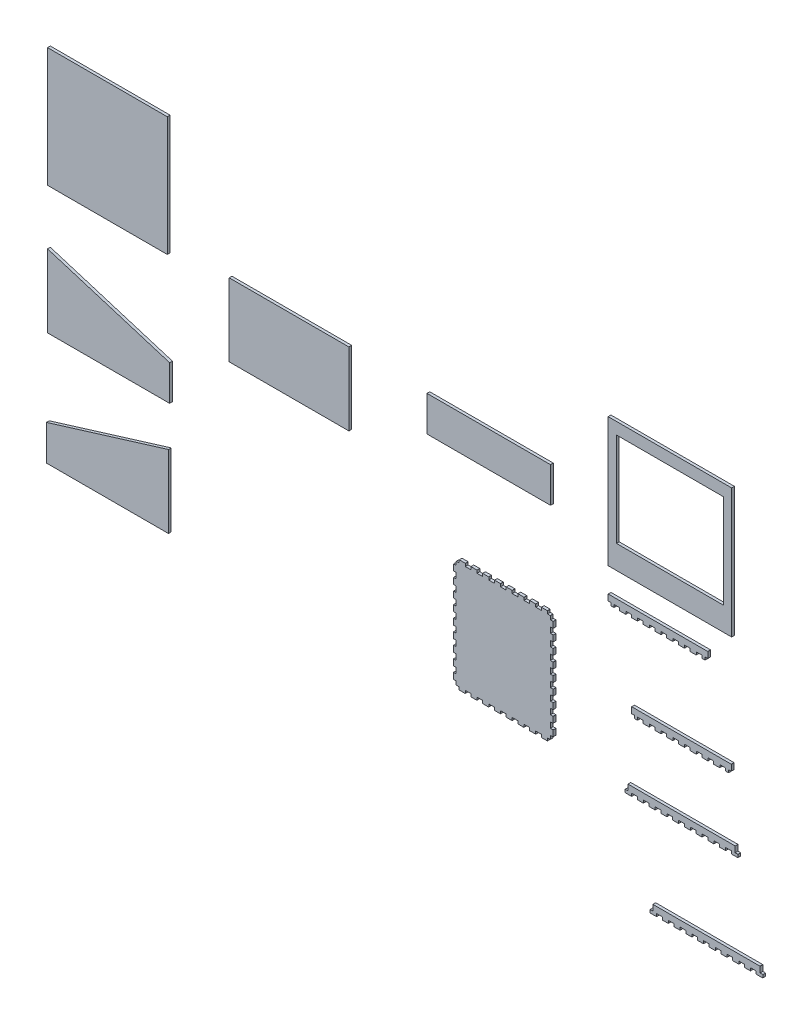
from build123d import *

# Parameters (mm, degrees)
BOSS_EXTRUDE1_DEPTH   = 3
LAYER_2_W             = 133.604
LAYER_2_H             = 139.7
LAYER_2_W_2           = 115.824
LAYER_2_H_2           = 101.6
BOSS_EXTRUDE2_DEPTH   = 3
BOSS_EXTRUDE3_DEPTH   = 3
LAYER_5_W             = 129.54
LAYER_5_H             = 78.74
BOSS_EXTRUDE4_DEPTH   = 3
BOSS_EXTRUDE5_DEPTH   = 3
LAYER_7_W             = 133.604
LAYER_7_H             = 38.1
BOSS_EXTRUDE6_DEPTH   = 3
LAYER_8_W             = 129.54
LAYER_8_H             = 129.032
BOSS_EXTRUDE7_DEPTH   = 3
BOSS_EXTRUDE8_DEPTH   = 3
BOSS_EXTRUDE8_2_DEPTH = 3
BOSS_EXTRUDE8_3_DEPTH = 3
BOSS_EXTRUDE8_4_DEPTH = 3


with BuildPart() as part:
    # Layer 3 → Boss-Extrude1 (new body)
    with BuildSketch(Plane.XY):
        Polygon((176.445680517, 644.154472161), (176.445680517, 682.254472161), (308.525680517, 722.894472161), (308.525680517, 644.154472161), align=None)
    extrude(amount=BOSS_EXTRUDE1_DEPTH)


with BuildPart() as body_2:
    # Layer 2 → Boss-Extrude2 (new body)
    with BuildSketch(Plane.XY):
        with Locations((851.016713692, 921.678278213)):
            Rectangle(LAYER_2_W, LAYER_2_H)
        with Locations((851.016713692, 928.028278213)):
            Rectangle(LAYER_2_W_2, LAYER_2_H_2, mode=Mode.SUBTRACT)
    extrude(amount=BOSS_EXTRUDE2_DEPTH)


with BuildPart() as body_3:
    # Layer 4 → Boss-Extrude3 (new body)
    with BuildSketch(Plane.XY):
        Polygon((177.715680517, 766.738278213), (177.715680517, 845.478278213), (309.795680517, 804.838278213), (309.795680517, 766.738278213), align=None)
    extrude(amount=BOSS_EXTRUDE3_DEPTH)


with BuildPart() as body_4:
    # Layer 5 → Boss-Extrude4 (new body)
    with BuildSketch(Plane.XY):
        with Locations((438.988588467, 877.228278213)):
            Rectangle(LAYER_5_W, LAYER_5_H)
    extrude(amount=BOSS_EXTRUDE4_DEPTH)


with BuildPart() as body_5:
    # Layer 6 → Boss-Extrude5 (new body)
    with BuildSketch(Plane.XY):
        Polygon((629.555478568, 654.788539442), (629.580878568, 654.813939442), (629.606278568, 654.839339442), (629.631678568, 654.864739442), (629.631678568, 657.760339442), (635.727678568, 657.760339442), (635.727678568, 654.864739442), (635.753078568, 654.839339442), (635.753078568, 654.813939442), (635.778478568, 654.788539442), (635.829278568, 654.763139442), (642.204678568, 654.763139442), (642.255478568, 654.788539442), (642.280878568, 654.813939442), (642.306278568, 654.839339442), (642.331678568, 654.864739442), (642.331678568, 657.760339442), (648.427678568, 657.760339442), (648.427678568, 654.864739442), (648.453078568, 654.839339442), (648.453078568, 654.813939442), (648.478478568, 654.788539442), (648.529278568, 654.763139442), (654.904678568, 654.763139442), (654.955478568, 654.788539442), (654.980878568, 654.813939442), (655.006278568, 654.839339442), (655.031678568, 654.864739442), (655.031678568, 657.760339442), (661.102278568, 657.760339442), (661.102278568, 654.864739442), (661.127678568, 654.839339442), (661.153078568, 654.813939442), (661.178478568, 654.788539442), (661.229278568, 654.763139442), (667.630078568, 654.763139442), (667.655478568, 654.788539442), (667.680878568, 654.788539442), (667.680878568, 654.813939442), (667.706278568, 654.813939442), (667.706278568, 654.839339442), (667.731678568, 654.864739442), (667.731678568, 657.760339442), (673.802278568, 657.760339442), (673.802278568, 654.864739442), (673.827678568, 654.839339442), (673.853078568, 654.813939442), (673.878478568, 654.788539442), (673.929278568, 654.763139442), (680.330078568, 654.763139442), (680.355478568, 654.788539442), (680.380878568, 654.788539442), (680.380878568, 654.813939442), (680.406278568, 654.813939442), (680.406278568, 654.839339442), (680.431678568, 654.864739442), (680.431678568, 657.760339442), (686.527678568, 657.760339442), (686.527678568, 654.864739442), (686.553078568, 654.839339442), (686.553078568, 654.813939442), (686.578478568, 654.788539442), (686.629278568, 654.763139442), (693.004678568, 654.763139442), (693.055478568, 654.788539442), (693.080878568, 654.813939442), (693.106278568, 654.839339442), (693.131678568, 654.864739442), (693.131678568, 657.760339442), (699.227678568, 657.760339442), (699.227678568, 654.864739442), (699.253078568, 654.839339442), (699.253078568, 654.813939442), (699.278478568, 654.788539442), (699.329278568, 654.763139442), (705.704678568, 654.763139442), (705.755478568, 654.788539442), (705.780878568, 654.813939442), (705.806278568, 654.839339442), (705.831678568, 654.864739442), (705.831678568, 657.760339442), (711.927678568, 657.760339442), (711.927678568, 654.864739442), (711.953078568, 654.839339442), (711.953078568, 654.813939442), (711.978478568, 654.788539442), (712.029278568, 654.763139442), (718.430078568, 654.763139442), (718.455478568, 654.788539442), (718.480878568, 654.788539442), (718.480878568, 654.813939442), (718.506278568, 654.813939442), (718.506278568, 654.839339442), (718.531678568, 654.864739442), (718.531678568, 657.760339442), (721.579678568, 657.760339442), (721.630478568, 657.785739442), (721.655878568, 657.811139442), (721.681278568, 657.811139442), (721.681278568, 657.836539442), (721.706678568, 657.861939442), (721.706678568, 661.697339442), (724.602278568, 661.697339442), (724.627678568, 661.722739442), (724.653078568, 661.722739442), (724.653078568, 661.748139442), (724.678478568, 661.773539442), (724.703878568, 661.824339442), (724.703878568, 668.199739442), (724.678478568, 668.225139442), (724.678478568, 668.250539442), (724.653078568, 668.250539442), (724.653078568, 668.275939442), (724.627678568, 668.275939442), (724.602278568, 668.301339442), (721.706678568, 668.301339442), (721.706678568, 674.397339442), (724.602278568, 674.397339442), (724.627678568, 674.422739442), (724.653078568, 674.422739442), (724.678478568, 674.448139442), (724.678478568, 674.473539442), (724.703878568, 674.498939442), (724.703878568, 680.899739442), (724.678478568, 680.950539442), (724.653078568, 680.975939442), (724.627678568, 681.001339442), (724.602278568, 681.001339442), (721.706678568, 681.001339442), (721.706678568, 687.097339442), (724.602278568, 687.097339442), (724.627678568, 687.122739442), (724.653078568, 687.122739442), (724.678478568, 687.148139442), (724.678478568, 687.173539442), (724.703878568, 687.198939442), (724.703878568, 693.599739442), (724.678478568, 693.650539442), (724.653078568, 693.675939442), (724.627678568, 693.701339442), (724.602278568, 693.701339442), (721.706678568, 693.701339442), (721.706678568, 699.797339442), (724.602278568, 699.797339442), (724.627678568, 699.822739442), (724.653078568, 699.822739442), (724.678478568, 699.848139442), (724.678478568, 699.873539442), (724.703878568, 699.898939442), (724.703878568, 706.299739442), (724.678478568, 706.325139442), (724.678478568, 706.350539442), (724.653078568, 706.350539442), (724.653078568, 706.375939442), (724.627678568, 706.375939442), (724.602278568, 706.401339442), (721.706678568, 706.401339442), (721.706678568, 712.497339442), (724.602278568, 712.497339442), (724.627678568, 712.522739442), (724.653078568, 712.522739442), (724.653078568, 712.548139442), (724.678478568, 712.573539442), (724.703878568, 712.624339442), (724.703878568, 718.999739442), (724.678478568, 719.025139442), (724.678478568, 719.050539442), (724.653078568, 719.050539442), (724.653078568, 719.075939442), (724.627678568, 719.075939442), (724.602278568, 719.101339442), (721.706678568, 719.101339442), (721.706678568, 725.197339442), (724.602278568, 725.197339442), (724.627678568, 725.222739442), (724.653078568, 725.222739442), (724.653078568, 725.248139442), (724.678478568, 725.273539442), (724.703878568, 725.324339442), (724.703878568, 731.699739442), (724.678478568, 731.750539442), (724.653078568, 731.775939442), (724.627678568, 731.801339442), (724.602278568, 731.801339442), (721.706678568, 731.801339442), (721.706678568, 737.897339442), (724.602278568, 737.897339442), (724.627678568, 737.922739442), (724.653078568, 737.922739442), (724.678478568, 737.948139442), (724.678478568, 737.973539442), (724.703878568, 737.998939442), (724.703878568, 744.399739442), (724.678478568, 744.450539442), (724.653078568, 744.475939442), (724.627678568, 744.501339442), (724.602278568, 744.501339442), (721.706678568, 744.501339442), (721.706678568, 750.597339442), (724.602278568, 750.597339442), (724.627678568, 750.622739442), (724.653078568, 750.622739442), (724.678478568, 750.648139442), (724.678478568, 750.673539442), (724.703878568, 750.698939442), (724.703878568, 757.099739442), (724.678478568, 757.150539442), (724.653078568, 757.175939442), (724.627678568, 757.201339442), (724.602278568, 757.201339442), (721.706678568, 757.201339442), (721.706678568, 763.297339442), (724.602278568, 763.297339442), (724.627678568, 763.322739442), (724.653078568, 763.322739442), (724.653078568, 763.348139442), (724.678478568, 763.373539442), (724.703878568, 763.424339442), (724.703878568, 769.799739442), (724.678478568, 769.825139442), (724.678478568, 769.850539442), (724.653078568, 769.850539442), (724.653078568, 769.875939442), (724.627678568, 769.875939442), (724.602278568, 769.901339442), (721.706678568, 769.901339442), (721.706678568, 773.736739442), (721.681278568, 773.762139442), (721.681278568, 773.787539442), (721.655878568, 773.812939442), (721.630478568, 773.812939442), (721.579678568, 773.838339442), (718.531678568, 773.838339442), (718.531678568, 776.733939442), (718.506278568, 776.784739442), (718.480878568, 776.810139442), (718.455478568, 776.835539442), (718.430078568, 776.835539442), (712.029278568, 776.835539442), (711.978478568, 776.835539442), (711.978478568, 776.810139442), (711.953078568, 776.810139442), (711.953078568, 776.784739442), (711.927678568, 776.733939442), (711.927678568, 773.838339442), (705.831678568, 773.838339442), (705.831678568, 776.733939442), (705.806278568, 776.784739442), (705.780878568, 776.784739442), (705.780878568, 776.810139442), (705.755478568, 776.810139442), (705.755478568, 776.835539442), (705.704678568, 776.835539442), (699.329278568, 776.835539442), (699.278478568, 776.835539442), (699.278478568, 776.810139442), (699.253078568, 776.810139442), (699.253078568, 776.784739442), (699.227678568, 776.733939442), (699.227678568, 773.838339442), (693.131678568, 773.838339442), (693.131678568, 776.733939442), (693.106278568, 776.784739442), (693.080878568, 776.784739442), (693.080878568, 776.810139442), (693.055478568, 776.810139442), (693.055478568, 776.835539442), (693.004678568, 776.835539442), (686.629278568, 776.835539442), (686.578478568, 776.835539442), (686.578478568, 776.810139442), (686.553078568, 776.810139442), (686.553078568, 776.784739442), (686.527678568, 776.733939442), (686.527678568, 773.838339442), (680.431678568, 773.838339442), (680.431678568, 776.733939442), (680.406278568, 776.784739442), (680.380878568, 776.810139442), (680.355478568, 776.835539442), (680.330078568, 776.835539442), (673.929278568, 776.835539442), (673.878478568, 776.835539442), (673.878478568, 776.810139442), (673.853078568, 776.810139442), (673.853078568, 776.784739442), (673.827678568, 776.784739442), (673.802278568, 776.733939442), (673.802278568, 773.838339442), (667.731678568, 773.838339442), (667.731678568, 776.733939442), (667.706278568, 776.784739442), (667.680878568, 776.810139442), (667.655478568, 776.835539442), (667.630078568, 776.835539442), (661.229278568, 776.835539442), (661.178478568, 776.835539442), (661.178478568, 776.810139442), (661.153078568, 776.810139442), (661.153078568, 776.784739442), (661.127678568, 776.784739442), (661.102278568, 776.733939442), (661.102278568, 773.838339442), (655.031678568, 773.838339442), (655.031678568, 776.733939442), (655.006278568, 776.784739442), (654.980878568, 776.784739442), (654.980878568, 776.810139442), (654.955478568, 776.810139442), (654.955478568, 776.835539442), (654.904678568, 776.835539442), (648.529278568, 776.835539442), (648.478478568, 776.835539442), (648.478478568, 776.810139442), (648.453078568, 776.810139442), (648.453078568, 776.784739442), (648.427678568, 776.733939442), (648.427678568, 773.838339442), (642.331678568, 773.838339442), (642.331678568, 776.733939442), (642.306278568, 776.784739442), (642.280878568, 776.784739442), (642.280878568, 776.810139442), (642.255478568, 776.810139442), (642.255478568, 776.835539442), (642.204678568, 776.835539442), (635.829278568, 776.835539442), (635.778478568, 776.835539442), (635.778478568, 776.810139442), (635.753078568, 776.810139442), (635.753078568, 776.784739442), (635.727678568, 776.733939442), (635.727678568, 773.838339442), (629.631678568, 773.838339442), (629.631678568, 776.733939442), (629.606278568, 776.784739442), (629.580878568, 776.784739442), (629.580878568, 776.810139442), (629.555478568, 776.810139442), (629.555478568, 776.835539442), (629.504678568, 776.835539442), (623.129278568, 776.835539442), (623.078478568, 776.835539442), (623.078478568, 776.810139442), (623.053078568, 776.810139442), (623.053078568, 776.784739442), (623.027678568, 776.784739442), (623.002278568, 776.733939442), (623.002278568, 773.838339442), (619.954278568, 773.838339442), (619.903478568, 773.812939442), (619.878078568, 773.812939442), (619.878078568, 773.787539442), (619.852678568, 773.762139442), (619.852678568, 773.736739442), (619.852678568, 769.901339442), (616.957078568, 769.901339442), (616.906278568, 769.875939442), (616.880878568, 769.850539442), (616.855478568, 769.825139442), (616.830078568, 769.799739442), (616.830078568, 763.424339442), (616.855478568, 763.373539442), (616.880878568, 763.373539442), (616.880878568, 763.348139442), (616.906278568, 763.322739442), (616.957078568, 763.297339442), (619.852678568, 763.297339442), (619.852678568, 757.201339442), (616.957078568, 757.201339442), (616.906278568, 757.201339442), (616.906278568, 757.175939442), (616.880878568, 757.175939442), (616.880878568, 757.150539442), (616.855478568, 757.150539442), (616.830078568, 757.099739442), (616.830078568, 750.698939442), (616.855478568, 750.673539442), (616.880878568, 750.648139442), (616.880878568, 750.622739442), (616.906278568, 750.622739442), (616.957078568, 750.597339442), (619.852678568, 750.597339442), (619.852678568, 744.501339442), (616.957078568, 744.501339442), (616.906278568, 744.501339442), (616.906278568, 744.475939442), (616.880878568, 744.475939442), (616.880878568, 744.450539442), (616.855478568, 744.450539442), (616.830078568, 744.399739442), (616.830078568, 737.998939442), (616.855478568, 737.973539442), (616.880878568, 737.948139442), (616.880878568, 737.922739442), (616.906278568, 737.922739442), (616.957078568, 737.897339442), (619.852678568, 737.897339442), (619.852678568, 731.801339442), (616.957078568, 731.801339442), (616.906278568, 731.801339442), (616.906278568, 731.775939442), (616.880878568, 731.775939442), (616.880878568, 731.750539442), (616.855478568, 731.750539442), (616.830078568, 731.699739442), (616.830078568, 725.324339442), (616.855478568, 725.273539442), (616.880878568, 725.273539442), (616.880878568, 725.248139442), (616.906278568, 725.222739442), (616.957078568, 725.197339442), (619.852678568, 725.197339442), (619.852678568, 719.101339442), (616.957078568, 719.101339442), (616.906278568, 719.075939442), (616.880878568, 719.050539442), (616.855478568, 719.025139442), (616.830078568, 718.999739442), (616.830078568, 712.624339442), (616.855478568, 712.573539442), (616.880878568, 712.573539442), (616.880878568, 712.548139442), (616.906278568, 712.522739442), (616.957078568, 712.497339442), (619.852678568, 712.497339442), (619.852678568, 706.401339442), (616.957078568, 706.401339442), (616.906278568, 706.375939442), (616.880878568, 706.350539442), (616.855478568, 706.325139442), (616.830078568, 706.299739442), (616.830078568, 699.898939442), (616.855478568, 699.873539442), (616.880878568, 699.848139442), (616.880878568, 699.822739442), (616.906278568, 699.822739442), (616.957078568, 699.797339442), (619.852678568, 699.797339442), (619.852678568, 693.701339442), (616.957078568, 693.701339442), (616.906278568, 693.701339442), (616.906278568, 693.675939442), (616.880878568, 693.675939442), (616.880878568, 693.650539442), (616.855478568, 693.650539442), (616.830078568, 693.599739442), (616.830078568, 687.198939442), (616.855478568, 687.173539442), (616.880878568, 687.148139442), (616.880878568, 687.122739442), (616.906278568, 687.122739442), (616.957078568, 687.097339442), (619.852678568, 687.097339442), (619.852678568, 681.001339442), (616.957078568, 681.001339442), (616.906278568, 681.001339442), (616.906278568, 680.975939442), (616.880878568, 680.975939442), (616.880878568, 680.950539442), (616.855478568, 680.950539442), (616.830078568, 680.899739442), (616.830078568, 674.498939442), (616.855478568, 674.473539442), (616.880878568, 674.448139442), (616.880878568, 674.422739442), (616.906278568, 674.422739442), (616.957078568, 674.397339442), (619.852678568, 674.397339442), (619.852678568, 668.301339442), (616.957078568, 668.301339442), (616.906278568, 668.275939442), (616.880878568, 668.250539442), (616.855478568, 668.225139442), (616.830078568, 668.199739442), (616.830078568, 661.824339442), (616.855478568, 661.773539442), (616.880878568, 661.773539442), (616.880878568, 661.748139442), (616.906278568, 661.722739442), (616.957078568, 661.697339442), (619.852678568, 661.697339442), (619.852678568, 657.861939442), (619.852678568, 657.836539442), (619.878078568, 657.811139442), (619.903478568, 657.785739442), (619.954278568, 657.760339442), (623.002278568, 657.760339442), (623.002278568, 654.864739442), (623.027678568, 654.839339442), (623.053078568, 654.813939442), (623.078478568, 654.788539442), (623.129278568, 654.763139442), (629.504678568, 654.763139442), align=None)
    extrude(amount=BOSS_EXTRUDE5_DEPTH)


with BuildPart() as body_6:
    # Layer 7 → Boss-Extrude6 (new body)
    with BuildSketch(Plane.XY):
        with Locations((655.031678568, 896.278278213)):
            Rectangle(LAYER_7_W, LAYER_7_H)
    extrude(amount=BOSS_EXTRUDE6_DEPTH)


with BuildPart() as body_7:
    # Layer 8 → Boss-Extrude7 (new body)
    with BuildSketch(Plane.XY):
        with Locations((242.485680517, 969.506478213)):
            Rectangle(LAYER_8_W, LAYER_8_H)
    extrude(amount=BOSS_EXTRUDE7_DEPTH)


with BuildPart() as body_8:
    # Layer 9 → Boss-Extrude8 (new body)
    with BuildSketch(Plane.XY):
        Polygon((815.964713692, 722.919872161), (815.990113692, 722.919872161), (816.015513692, 722.945272161), (816.015513692, 722.970672161), (816.040913692, 722.996072161), (816.040913692, 725.891672161), (822.136913692, 725.891672161), (822.136913692, 722.996072161), (822.162313692, 722.970672161), (822.162313692, 722.945272161), (822.187713692, 722.919872161), (822.213113692, 722.919872161), (822.238513692, 722.894472161), (828.639313692, 722.894472161), (828.690113692, 722.919872161), (828.715513692, 722.945272161), (828.740913692, 722.970672161), (828.766313692, 722.996072161), (828.766313692, 725.891672161), (834.836913692, 725.891672161), (834.836913692, 722.996072161), (834.862313692, 722.970672161), (834.862313692, 722.945272161), (834.887713692, 722.919872161), (834.913113692, 722.919872161), (834.938513692, 722.894472161), (841.339313692, 722.894472161), (841.390113692, 722.919872161), (841.415513692, 722.945272161), (841.440913692, 722.970672161), (841.466313692, 722.996072161), (841.466313692, 725.891672161), (847.536913692, 725.891672161), (847.536913692, 722.996072161), (847.562313692, 722.970672161), (847.562313692, 722.945272161), (847.587713692, 722.919872161), (847.613113692, 722.919872161), (847.638513692, 722.894472161), (854.039313692, 722.894472161), (854.064713692, 722.919872161), (854.090113692, 722.919872161), (854.115513692, 722.945272161), (854.115513692, 722.970672161), (854.140913692, 722.996072161), (854.140913692, 725.891672161), (860.236913692, 725.891672161), (860.236913692, 722.996072161), (860.262313692, 722.970672161), (860.262313692, 722.945272161), (860.287713692, 722.945272161), (860.313113692, 722.919872161), (860.363913692, 722.894472161), (866.739313692, 722.894472161), (866.764713692, 722.919872161), (866.790113692, 722.919872161), (866.815513692, 722.945272161), (866.815513692, 722.970672161), (866.840913692, 722.996072161), (866.840913692, 725.891672161), (872.936913692, 725.891672161), (872.936913692, 722.996072161), (872.962313692, 722.970672161), (872.962313692, 722.945272161), (872.987713692, 722.945272161), (873.013113692, 722.919872161), (873.063913692, 722.894472161), (879.439313692, 722.894472161), (879.490113692, 722.919872161), (879.515513692, 722.945272161), (879.540913692, 722.970672161), (879.566313692, 722.996072161), (879.566313692, 725.891672161), (885.636913692, 725.891672161), (885.636913692, 722.996072161), (885.662313692, 722.970672161), (885.662313692, 722.945272161), (885.687713692, 722.919872161), (885.713113692, 722.919872161), (885.738513692, 722.894472161), (892.139313692, 722.894472161), (892.190113692, 722.919872161), (892.215513692, 722.945272161), (892.240913692, 722.970672161), (892.266313692, 722.996072161), (892.266313692, 725.891672161), (898.336913692, 725.891672161), (898.336913692, 722.996072161), (898.362313692, 722.970672161), (898.362313692, 722.945272161), (898.387713692, 722.919872161), (898.413113692, 722.919872161), (898.438513692, 722.894472161), (904.839313692, 722.894472161), (904.890113692, 722.919872161), (904.915513692, 722.945272161), (904.940913692, 722.970672161), (904.966313692, 722.996072161), (904.966313692, 725.891672161), (911.036913692, 725.891672161), (911.036913692, 722.996072161), (911.062313692, 722.970672161), (911.062313692, 722.945272161), (911.087713692, 722.945272161), (911.113113692, 722.919872161), (911.163913692, 722.894472161), (914.364313692, 722.894472161), (914.415113692, 722.919872161), (914.440513692, 722.945272161), (914.465913692, 722.970672161), (914.465913692, 722.996072161), (914.465913692, 725.891672161), (917.361513692, 725.891672161), (917.412313692, 725.917072161), (917.437713692, 725.942472161), (917.437713692, 725.967872161), (917.463113692, 725.967872161), (917.463113692, 726.018672161), (917.463113692, 732.394072161), (917.463113692, 732.419472161), (917.437713692, 732.444872161), (917.437713692, 732.470272161), (917.412313692, 732.470272161), (917.361513692, 732.495672161), (809.716313692, 732.495672161), (809.690913692, 732.470272161), (809.665513692, 732.470272161), (809.640113692, 732.444872161), (809.640113692, 732.419472161), (809.614713692, 732.394072161), (809.614713692, 726.018672161), (809.640113692, 725.967872161), (809.665513692, 725.942472161), (809.665513692, 725.917072161), (809.690913692, 725.917072161), (809.716313692, 725.891672161), (812.611913692, 725.891672161), (812.611913692, 722.996072161), (812.637313692, 722.970672161), (812.637313692, 722.945272161), (812.662713692, 722.945272161), (812.662713692, 722.919872161), (812.688113692, 722.919872161), (812.713513692, 722.894472161), (815.939313692, 722.894472161), align=None)
    extrude(amount=BOSS_EXTRUDE8_DEPTH)


with BuildPart() as body_9:
    # Layer 9 → Boss-Extrude8 2 (new body)
    with BuildSketch(Plane.XY):
        Polygon((790.564713692, 815.811078213), (790.590113692, 815.811078213), (790.615513692, 815.836478213), (790.615513692, 815.861878213), (790.640913692, 815.912678213), (790.640913692, 818.782878213), (796.736913692, 818.782878213), (796.736913692, 815.912678213), (796.762313692, 815.861878213), (796.762313692, 815.836478213), (796.787713692, 815.811078213), (796.813113692, 815.811078213), (796.838513692, 815.785678213), (803.239313692, 815.785678213), (803.290113692, 815.811078213), (803.315513692, 815.836478213), (803.315513692, 815.861878213), (803.340913692, 815.861878213), (803.366313692, 815.912678213), (803.366313692, 818.782878213), (809.436913692, 818.782878213), (809.436913692, 815.912678213), (809.462313692, 815.861878213), (809.462313692, 815.836478213), (809.487713692, 815.811078213), (809.513113692, 815.811078213), (809.538513692, 815.785678213), (815.939313692, 815.785678213), (815.990113692, 815.811078213), (816.015513692, 815.836478213), (816.015513692, 815.861878213), (816.040913692, 815.861878213), (816.066313692, 815.912678213), (816.066313692, 818.782878213), (822.136913692, 818.782878213), (822.136913692, 815.912678213), (822.162313692, 815.861878213), (822.162313692, 815.836478213), (822.187713692, 815.811078213), (822.213113692, 815.811078213), (822.238513692, 815.785678213), (828.639313692, 815.785678213), (828.664713692, 815.811078213), (828.690113692, 815.811078213), (828.715513692, 815.836478213), (828.715513692, 815.861878213), (828.740913692, 815.912678213), (828.740913692, 818.782878213), (834.836913692, 818.782878213), (834.836913692, 815.912678213), (834.862313692, 815.861878213), (834.887713692, 815.836478213), (834.913113692, 815.811078213), (834.963913692, 815.785678213), (841.339313692, 815.785678213), (841.364713692, 815.811078213), (841.390113692, 815.811078213), (841.415513692, 815.836478213), (841.415513692, 815.861878213), (841.440913692, 815.912678213), (841.440913692, 818.782878213), (847.536913692, 818.782878213), (847.536913692, 815.912678213), (847.562313692, 815.861878213), (847.587713692, 815.836478213), (847.613113692, 815.811078213), (847.663913692, 815.785678213), (854.039313692, 815.785678213), (854.090113692, 815.811078213), (854.115513692, 815.836478213), (854.115513692, 815.861878213), (854.140913692, 815.861878213), (854.166313692, 815.912678213), (854.166313692, 818.782878213), (860.236913692, 818.782878213), (860.236913692, 815.912678213), (860.262313692, 815.861878213), (860.262313692, 815.836478213), (860.287713692, 815.811078213), (860.313113692, 815.811078213), (860.338513692, 815.785678213), (866.739313692, 815.785678213), (866.790113692, 815.811078213), (866.815513692, 815.836478213), (866.815513692, 815.861878213), (866.840913692, 815.861878213), (866.866313692, 815.912678213), (866.866313692, 818.782878213), (872.936913692, 818.782878213), (872.936913692, 815.912678213), (872.962313692, 815.861878213), (872.962313692, 815.836478213), (872.987713692, 815.811078213), (873.013113692, 815.811078213), (873.038513692, 815.785678213), (879.439313692, 815.785678213), (879.490113692, 815.811078213), (879.515513692, 815.836478213), (879.515513692, 815.861878213), (879.540913692, 815.861878213), (879.566313692, 815.912678213), (879.566313692, 818.782878213), (885.636913692, 818.782878213), (885.636913692, 815.912678213), (885.662313692, 815.861878213), (885.687713692, 815.836478213), (885.713113692, 815.811078213), (885.763913692, 815.785678213), (888.964313692, 815.785678213), (889.015113692, 815.811078213), (889.040513692, 815.836478213), (889.040513692, 815.861878213), (889.065913692, 815.861878213), (889.065913692, 815.912678213), (889.065913692, 818.782878213), (891.961513692, 818.782878213), (892.012313692, 818.808278213), (892.037713692, 818.833678213), (892.037713692, 818.859078213), (892.063113692, 818.859078213), (892.063113692, 818.909878213), (892.063113692, 825.285278213), (892.063113692, 825.310678213), (892.037713692, 825.336078213), (892.037713692, 825.361478213), (892.012313692, 825.361478213), (891.961513692, 825.386878213), (784.316313692, 825.386878213), (784.290913692, 825.361478213), (784.265513692, 825.361478213), (784.240113692, 825.336078213), (784.240113692, 825.310678213), (784.214713692, 825.285278213), (784.214713692, 818.909878213), (784.240113692, 818.859078213), (784.265513692, 818.833678213), (784.265513692, 818.808278213), (784.290913692, 818.808278213), (784.316313692, 818.782878213), (787.211913692, 818.782878213), (787.211913692, 815.912678213), (787.237313692, 815.861878213), (787.262713692, 815.836478213), (787.262713692, 815.811078213), (787.288113692, 815.811078213), (787.313513692, 815.785678213), (790.539313692, 815.785678213), align=None)
    extrude(amount=BOSS_EXTRUDE8_2_DEPTH)


with BuildPart() as body_10:
    # Layer 9 → Boss-Extrude8 3 (new body)
    with BuildSketch(Plane.XY):
        Polygon((836.614913692, 549.22072238), (836.640313692, 549.24612238), (836.665713692, 549.27152238), (836.665713692, 549.29692238), (836.665713692, 552.19252238), (842.761713692, 552.19252238), (842.761713692, 549.29692238), (842.787113692, 549.27152238), (842.787113692, 549.24612238), (842.812513692, 549.22072238), (842.837913692, 549.22072238), (842.863313692, 549.19532238), (849.264113692, 549.19532238), (849.289513692, 549.22072238), (849.314913692, 549.22072238), (849.314913692, 549.24612238), (849.340313692, 549.24612238), (849.340313692, 549.27152238), (849.365713692, 549.29692238), (849.365713692, 552.19252238), (855.461713692, 552.19252238), (855.461713692, 549.29692238), (855.487113692, 549.27152238), (855.487113692, 549.24612238), (855.512513692, 549.24612238), (855.537913692, 549.22072238), (855.588713692, 549.19532238), (861.964113692, 549.19532238), (861.989513692, 549.22072238), (862.014913692, 549.22072238), (862.014913692, 549.24612238), (862.040313692, 549.24612238), (862.040313692, 549.27152238), (862.065713692, 549.29692238), (862.065713692, 552.19252238), (868.161713692, 552.19252238), (868.161713692, 549.29692238), (868.187113692, 549.27152238), (868.187113692, 549.24612238), (868.212513692, 549.24612238), (868.237913692, 549.22072238), (868.288713692, 549.19532238), (874.664113692, 549.19532238), (874.689513692, 549.22072238), (874.714913692, 549.22072238), (874.714913692, 549.24612238), (874.740313692, 549.24612238), (874.740313692, 549.27152238), (874.765713692, 549.29692238), (874.765713692, 552.19252238), (880.861713692, 552.19252238), (880.861713692, 549.29692238), (880.887113692, 549.27152238), (880.887113692, 549.24612238), (880.912513692, 549.22072238), (880.937913692, 549.22072238), (880.963313692, 549.19532238), (887.364113692, 549.19532238), (887.414913692, 549.22072238), (887.440313692, 549.24612238), (887.465713692, 549.27152238), (887.465713692, 549.29692238), (887.465713692, 552.19252238), (893.561713692, 552.19252238), (893.561713692, 549.29692238), (893.587113692, 549.27152238), (893.587113692, 549.24612238), (893.612513692, 549.22072238), (893.637913692, 549.22072238), (893.663313692, 549.19532238), (900.064113692, 549.19532238), (900.114913692, 549.22072238), (900.140313692, 549.24612238), (900.165713692, 549.27152238), (900.165713692, 549.29692238), (900.165713692, 552.19252238), (906.261713692, 552.19252238), (906.261713692, 549.29692238), (906.287113692, 549.27152238), (906.287113692, 549.24612238), (906.312513692, 549.24612238), (906.337913692, 549.22072238), (906.388713692, 549.19532238), (912.764113692, 549.19532238), (912.789513692, 549.22072238), (912.814913692, 549.22072238), (912.814913692, 549.24612238), (912.840313692, 549.24612238), (912.840313692, 549.27152238), (912.865713692, 549.29692238), (912.865713692, 552.19252238), (918.961713692, 552.19252238), (918.961713692, 549.29692238), (918.987113692, 549.27152238), (918.987113692, 549.24612238), (919.012513692, 549.24612238), (919.037913692, 549.22072238), (919.088713692, 549.19532238), (925.464113692, 549.19532238), (925.489513692, 549.22072238), (925.514913692, 549.22072238), (925.514913692, 549.24612238), (925.540313692, 549.24612238), (925.540313692, 549.27152238), (925.565713692, 549.29692238), (925.565713692, 552.19252238), (931.661713692, 552.19252238), (931.661713692, 549.29692238), (931.687113692, 549.27152238), (931.687113692, 549.24612238), (931.712513692, 549.24612238), (931.737913692, 549.22072238), (931.788713692, 549.19532238), (938.164113692, 549.19532238), (938.214913692, 549.22072238), (938.240313692, 549.24612238), (938.265713692, 549.27152238), (938.265713692, 549.29692238), (938.265713692, 552.19252238), (944.361713692, 552.19252238), (944.361713692, 549.29692238), (944.387113692, 549.27152238), (944.387113692, 549.24612238), (944.412513692, 549.22072238), (944.437913692, 549.22072238), (944.463313692, 549.19532238), (951.448313692, 549.19532238), (951.499113692, 549.22072238), (951.524513692, 549.24612238), (951.549913692, 549.27152238), (951.549913692, 549.29692238), (951.549913692, 552.34492238), (951.549913692, 552.39572238), (951.524513692, 552.39572238), (951.524513692, 552.42112238), (951.499113692, 552.42112238), (951.499113692, 552.44652238), (951.448313692, 552.44652238), (948.552713692, 552.44652238), (948.552713692, 558.69492238), (948.527313692, 558.72032238), (948.527313692, 558.74572238), (948.501913692, 558.77112238), (948.476513692, 558.77112238), (948.451113692, 558.79652238), (832.576313692, 558.79652238), (832.550913692, 558.77112238), (832.525513692, 558.77112238), (832.525513692, 558.74572238), (832.500113692, 558.74572238), (832.500113692, 558.72032238), (832.474713692, 558.69492238), (832.474713692, 552.44652238), (829.579113692, 552.44652238), (829.553713692, 552.44652238), (829.528313692, 552.42112238), (829.502913692, 552.39572238), (829.477513692, 552.34492238), (829.477513692, 549.29692238), (829.502913692, 549.27152238), (829.502913692, 549.24612238), (829.528313692, 549.24612238), (829.528313692, 549.22072238), (829.553713692, 549.22072238), (829.579113692, 549.19532238), (836.564113692, 549.19532238), align=None)
    extrude(amount=BOSS_EXTRUDE8_3_DEPTH)


with BuildPart() as body_11:
    # Layer 9 → Boss-Extrude8 4 (new body)
    with BuildSketch(Plane.XY):
        Polygon((809.640113692, 648.413139442), (809.665513692, 648.438539442), (809.690913692, 648.463939442), (809.690913692, 648.489339442), (809.690913692, 651.384939442), (815.786913692, 651.384939442), (815.786913692, 648.489339442), (815.812313692, 648.463939442), (815.812313692, 648.438539442), (815.837713692, 648.413139442), (815.863113692, 648.413139442), (815.888513692, 648.387739442), (822.289313692, 648.387739442), (822.314713692, 648.413139442), (822.340113692, 648.413139442), (822.340113692, 648.438539442), (822.365513692, 648.438539442), (822.365513692, 648.463939442), (822.390913692, 648.489339442), (822.390913692, 651.384939442), (828.486913692, 651.384939442), (828.486913692, 648.489339442), (828.512313692, 648.463939442), (828.512313692, 648.438539442), (828.537713692, 648.438539442), (828.563113692, 648.413139442), (828.613913692, 648.387739442), (834.989313692, 648.387739442), (835.014713692, 648.413139442), (835.040113692, 648.413139442), (835.040113692, 648.438539442), (835.065513692, 648.438539442), (835.065513692, 648.463939442), (835.090913692, 648.489339442), (835.090913692, 651.384939442), (841.186913692, 651.384939442), (841.186913692, 648.489339442), (841.212313692, 648.463939442), (841.212313692, 648.438539442), (841.237713692, 648.438539442), (841.263113692, 648.413139442), (841.313913692, 648.387739442), (847.689313692, 648.387739442), (847.714713692, 648.413139442), (847.740113692, 648.413139442), (847.740113692, 648.438539442), (847.765513692, 648.438539442), (847.765513692, 648.463939442), (847.790913692, 648.489339442), (847.790913692, 651.384939442), (853.886913692, 651.384939442), (853.886913692, 648.489339442), (853.912313692, 648.463939442), (853.912313692, 648.438539442), (853.937713692, 648.413139442), (853.963113692, 648.413139442), (853.988513692, 648.387739442), (860.389313692, 648.387739442), (860.440113692, 648.413139442), (860.465513692, 648.438539442), (860.490913692, 648.463939442), (860.490913692, 648.489339442), (860.490913692, 651.384939442), (866.586913692, 651.384939442), (866.586913692, 648.489339442), (866.612313692, 648.463939442), (866.612313692, 648.438539442), (866.637713692, 648.413139442), (866.663113692, 648.413139442), (866.688513692, 648.387739442), (873.089313692, 648.387739442), (873.140113692, 648.413139442), (873.165513692, 648.438539442), (873.190913692, 648.463939442), (873.190913692, 648.489339442), (873.190913692, 651.384939442), (879.286913692, 651.384939442), (879.286913692, 648.489339442), (879.312313692, 648.463939442), (879.312313692, 648.438539442), (879.337713692, 648.438539442), (879.363113692, 648.413139442), (879.413913692, 648.387739442), (885.789313692, 648.387739442), (885.814713692, 648.413139442), (885.840113692, 648.413139442), (885.840113692, 648.438539442), (885.865513692, 648.438539442), (885.865513692, 648.463939442), (885.890913692, 648.489339442), (885.890913692, 651.384939442), (891.986913692, 651.384939442), (891.986913692, 648.489339442), (892.012313692, 648.463939442), (892.012313692, 648.438539442), (892.037713692, 648.438539442), (892.063113692, 648.413139442), (892.113913692, 648.387739442), (898.489313692, 648.387739442), (898.514713692, 648.413139442), (898.540113692, 648.413139442), (898.540113692, 648.438539442), (898.565513692, 648.438539442), (898.565513692, 648.463939442), (898.590913692, 648.489339442), (898.590913692, 651.384939442), (904.686913692, 651.384939442), (904.686913692, 648.489339442), (904.712313692, 648.463939442), (904.712313692, 648.438539442), (904.737713692, 648.438539442), (904.763113692, 648.413139442), (904.813913692, 648.387739442), (911.189313692, 648.387739442), (911.240113692, 648.413139442), (911.265513692, 648.438539442), (911.290913692, 648.463939442), (911.290913692, 648.489339442), (911.290913692, 651.384939442), (917.386913692, 651.384939442), (917.386913692, 648.489339442), (917.412313692, 648.463939442), (917.412313692, 648.438539442), (917.437713692, 648.413139442), (917.463113692, 648.413139442), (917.488513692, 648.387739442), (924.473513692, 648.387739442), (924.524313692, 648.413139442), (924.549713692, 648.438539442), (924.575113692, 648.463939442), (924.575113692, 648.489339442), (924.575113692, 651.537339442), (924.575113692, 651.588139442), (924.549713692, 651.588139442), (924.549713692, 651.613539442), (924.524313692, 651.613539442), (924.524313692, 651.638939442), (924.473513692, 651.638939442), (921.577913692, 651.638939442), (921.577913692, 657.887339442), (921.552513692, 657.912739442), (921.552513692, 657.938139442), (921.527113692, 657.963539442), (921.501713692, 657.963539442), (921.476313692, 657.988939442), (805.601513692, 657.988939442), (805.576113692, 657.963539442), (805.550713692, 657.963539442), (805.550713692, 657.938139442), (805.525313692, 657.938139442), (805.525313692, 657.912739442), (805.499913692, 657.887339442), (805.499913692, 651.638939442), (802.604313692, 651.638939442), (802.578913692, 651.638939442), (802.553513692, 651.613539442), (802.528113692, 651.588139442), (802.502713692, 651.537339442), (802.502713692, 648.489339442), (802.528113692, 648.463939442), (802.528113692, 648.438539442), (802.553513692, 648.438539442), (802.553513692, 648.413139442), (802.578913692, 648.413139442), (802.604313692, 648.387739442), (809.589313692, 648.387739442), align=None)
    extrude(amount=BOSS_EXTRUDE8_4_DEPTH)


solid = Compound([part.part, body_2.part, body_3.part, body_4.part, body_5.part, body_6.part, body_7.part, body_8.part, body_9.part, body_10.part, body_11.part])
